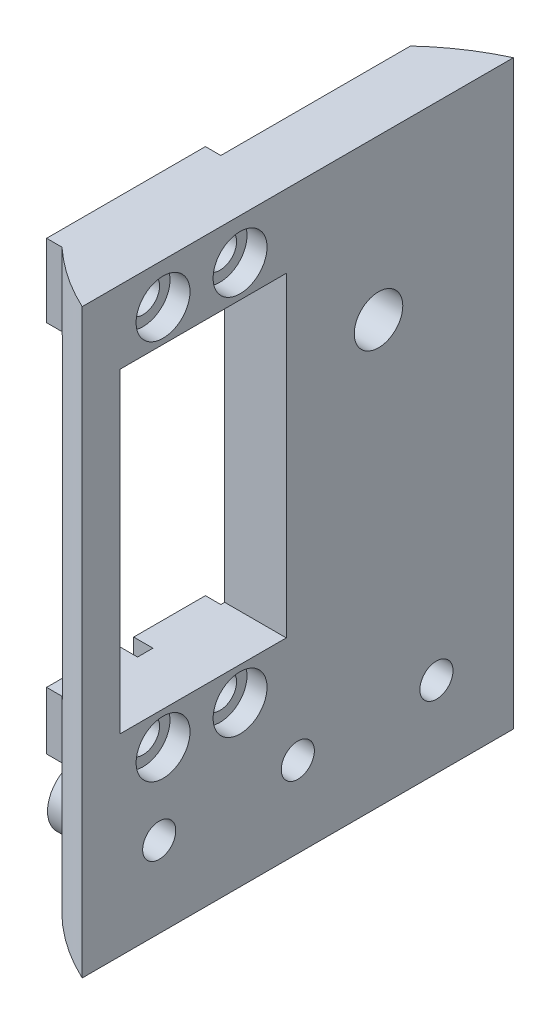
from build123d import *
from build123d.topology import SkipClean

# Parameters (mm, degrees)
SKETCH1_R                = 28
BOSS_EXTRUDE1_DEPTH      = 3
SKETCH2_R                = 1.625
CUT_EXTRUDE1_DEPTH       = 3
BOSS_EXTRUDE4_START      = 3
BOSS_EXTRUDE4_OUTLINE_R  = 1.625
BOSS_EXTRUDE4_DEPTH      = 70
BOSS_EXTRUDE6_DEPTH      = 7
CUT_EXTRUDE13_START      = -10
CUT_EXTRUDE13_DEPTH      = 10
SKETCH14_R               = 3.15
CUT_EXTRUDE7_DEPTH       = 54
SKETCH17_R               = 2.15
CUT_EXTRUDE10_DEPTH      = 15.8
CUT_EXTRUDE12_START      = -3
CUT_EXTRUDE12_DEPTH      = 3
SKETCH21_W               = 20.621892052
SKETCH21_H               = 10
BOSS_EXTRUDE7_DEPTH      = 7
SKETCH23_R               = 2.15
CUT_EXTRUDE17_DEPTH      = 23
SKETCH26_W               = 20.621892052
SKETCH26_H               = 58
CUT_EXTRUDE21_DEPTH      = 5
CUT_EXTRUDE22_DEPTH      = 5
SKETCH41_R               = 1.625
CUT_EXTRUDE23_DEPTH      = 70
CUT_EXTRUDE24_START      = -39
CUT_EXTRUDE24_DEPTH      = 39
BOSS_EXTRUDE12_START     = -3
SKETCH43_R               = 30.866648668
BOSS_EXTRUDE12_DEPTH     = 3
BOSS_EXTRUDE13_DEPTH     = 70
BOSS_EXTRUDE14_DEPTH     = 70
SKETCH47_R               = 1.625
SKETCH47_R_2             = 1.65
CUT_EXTRUDE26_DEPTH      = 39
SKETCH51_R               = 3.5
CUT_EXTRUDE30_DEPTH      = 2.6
CUT_EXTRUDE31_DEPTH      = 79
CUT_EXTRUDE31_DEPTH_BACK = 23
SKETCH53_R               = 2.15
CUT_EXTRUDE32_DEPTH      = 17
SKETCH56_R               = 4
SKETCH56_R_2             = 2.15
BOSS_EXTRUDE15_DEPTH     = 2.5
SKETCH57_W               = 20.621892052
SKETCH57_H               = 40
CUT_EXTRUDE33_DEPTH      = 10
SKETCH58_W               = 2
SKETCH58_H               = 6.5
CUT_EXTRUDE34_DEPTH      = 2.5
SKETCH59_R               = 1.65
BOSS_EXTRUDE16_DEPTH     = 2.5


# Read off the part's stored shape, not the designer's step: Boss-Extrude4, Cut-Extrude13
with BuildPart() as part:
    # Sketch1 → Boss-Extrude1 (new body)
    with BuildSketch(Plane(origin=(0, 0, 0), x_dir=(1, 0, 0), z_dir=(0, 1, 0))):
        with Locations(Location((20, 12.5, 0), (0, 0, 270))):
            Circle(SKETCH1_R)
    extrude(amount=BOSS_EXTRUDE1_DEPTH)

    # Sketch2 → Cut-Extrude1 (cut)
    with BuildSketch(Plane(origin=(0, 3, 0), x_dir=(1, 0, 0), z_dir=(0, 1, 0))):
        with Locations(Location((20, 19.5, 0), (0, 0, 270))):
            Circle(SKETCH2_R)
        with Locations(Location((20, 5.5, 0), (0, 0, 270))):
            Circle(SKETCH2_R)
        with Locations(Location((20, 12.5, 0), (0, 0, 270))):
            Circle(SKETCH2_R)
    extrude(amount=-CUT_EXTRUDE1_DEPTH, mode=Mode.SUBTRACT)

    # Boss-Extrude4 outline → Boss-Extrude4 (add)
    with SkipClean():  # the faces are left unmerged after this step: merging them gives an invalid solid
        with BuildSketch(Plane(origin=(0, 0, 0), x_dir=(1, 0, 0), z_dir=(0, 1, 0)).offset(BOSS_EXTRUDE4_START)):
            with BuildLine():
                ThreePointArc((3.5, -10.121892052), (48, 12.5), (3.5, 35.121892052))
                Line((3.5, 35.121892052), (3.5, -10.121892052))
            make_face()
            with Locations((20, 5.5)):
                Circle(BOSS_EXTRUDE4_OUTLINE_R, mode=Mode.SUBTRACT)
            with Locations((20, 12.5)):
                Circle(BOSS_EXTRUDE4_OUTLINE_R, mode=Mode.SUBTRACT)
            with Locations((20, 19.5)):
                Circle(BOSS_EXTRUDE4_OUTLINE_R, mode=Mode.SUBTRACT)
        extrude(amount=BOSS_EXTRUDE4_DEPTH)
    add(part.part.scale(1), mode=Mode.REPLACE)  # the faces are merged on a copy

    # Sketch13 → Boss-Extrude6 (add)
    with BuildSketch(Plane.ZY.offset(-3.5)):
        Polygon((-10, 23), (10, 23), (10.121892052, 23), (10.121892052, 15), (10, 15), (-10, 15), (-10.5, 15), (-10.5, 23), align=None)
    extrude(amount=BOSS_EXTRUDE6_DEPTH)

    # Cut-Extrude13 outline → Cut-Extrude13 (cut)
    with BuildSketch(Plane.ZY.offset(-3.5).offset(CUT_EXTRUDE13_START)):
        with BuildLine():
            Line((-10.5, 33), (-10.5, 23))
            Line((-10.5, 23), (10.121892052, 23))
            Line((10.121892052, 23), (10.121892052, 35.792364821))
            ThreePointArc((10.121892052, 35.792364821), (-1.408923961, 43.405043646), (-10.5, 33))
        make_face()
    extrude(amount=CUT_EXTRUDE13_DEPTH, mode=Mode.SUBTRACT)

    # Sketch14 → Cut-Extrude7 (cut)
    with BuildSketch(Plane.ZY.offset(-3.5)):
        with Locations((-22.981333294, 52.283628291)):
            Circle(SKETCH14_R)
    extrude(amount=-CUT_EXTRUDE7_DEPTH, mode=Mode.SUBTRACT)

    # Sketch17 → Cut-Extrude10 (cut)
    with BuildSketch(Plane.ZY.offset(3.5)):
        with Locations((-5, 18.2)):
            Circle(SKETCH17_R)
        with Locations((5, 18.2)):
            Circle(SKETCH17_R)
    extrude(amount=-CUT_EXTRUDE10_DEPTH, mode=Mode.SUBTRACT)

    # Sketch19 → Cut-Extrude12 (cut)
    with BuildSketch(Plane.ZY.offset(-3.5).offset(CUT_EXTRUDE12_START)):
        with BuildLine():
            Line((10.121892052, 63), (10.121892052, 35.792364821))
            ThreePointArc((10.121892052, 35.792364821), (-1.408923961, 43.405043646), (-10.5, 33))
            Line((-10.5, 33), (-10.5, 62))
            Line((-10.5, 62), (-10.5, 63))
            Line((-10.5, 63), (10.121892052, 63))
        make_face()
    extrude(amount=CUT_EXTRUDE12_DEPTH, mode=Mode.SUBTRACT)

    # Sketch21 → Boss-Extrude7 (add)
    with BuildSketch(Plane.ZY.offset(-3.5)):
        with Locations((-0.189053974, 68)):
            Rectangle(SKETCH21_W, SKETCH21_H)
    extrude(amount=BOSS_EXTRUDE7_DEPTH)

    # Sketch23 → Cut-Extrude17 (cut)
    with BuildSketch(Plane.ZY.offset(3.5)):
        with Locations((-5, 67.7)):
            Circle(SKETCH23_R)
        with Locations((5, 67.7)):
            Circle(SKETCH23_R)
    extrude(amount=-CUT_EXTRUDE17_DEPTH, mode=Mode.SUBTRACT)

    # Sketch26 → Cut-Extrude21 (cut)
    with BuildSketch(Plane.ZY.offset(3.5)):
        with Locations((-0.189053974, 44)):
            Rectangle(SKETCH26_W, SKETCH26_H)
    extrude(amount=-CUT_EXTRUDE21_DEPTH, mode=Mode.SUBTRACT)

    # Sketch27 → Cut-Extrude22 (cut)
    with BuildSketch(Plane.ZY.offset(-6.5)):
        Polygon((10.121892052, 63), (-10.5, 63), (-10.5, 33), (10.121892052, 35.792364821), align=None)
    extrude(amount=-CUT_EXTRUDE22_DEPTH, mode=Mode.SUBTRACT)

    # Sketch41 → Cut-Extrude23 (cut)
    with BuildSketch(Plane(origin=(0, 73, 0), x_dir=(1, 0, 0), z_dir=(0, 1, 0))):
        with BuildLine():
            Line((11.5, 39.178643144), (11.5, 10.5))
            Line((11.5, 10.5), (11.5, -14.178643144))
            ThreePointArc((11.5, -14.178643144), (48, 12.5), (11.5, 39.178643144))
        make_face()
        with Locations(Location((20, 5.5, 0), (0, 0, 270))):
            Circle(SKETCH41_R, mode=Mode.SUBTRACT)
        with Locations(Location((20, 12.5, 0), (0, 0, 270))):
            Circle(SKETCH41_R, mode=Mode.SUBTRACT)
        with Locations(Location((20, 19.5, 0), (0, 0, 270))):
            Circle(SKETCH41_R, mode=Mode.SUBTRACT)
    extrude(amount=-CUT_EXTRUDE23_DEPTH, mode=Mode.SUBTRACT)

    # Sketch42 → Cut-Extrude24 (cut)
    with SkipClean():  # the faces are left unmerged after this step: merging them gives an invalid solid
        with BuildSketch(Plane(origin=(0, 3, 0), x_dir=(1, 0, 0), z_dir=(0, 1, 0)).offset(CUT_EXTRUDE24_START)):
            with BuildLine():
                ThreePointArc((3.5, 35.121892052), (-6.366648668, 12.5), (3.5, -10.121892052))
                ThreePointArc((3.5, -10.121892052), (-8, 12.5), (3.5, 35.121892052))
            make_face()
        extrude(amount=CUT_EXTRUDE24_DEPTH, mode=Mode.SUBTRACT)

    # Sketch43 → Boss-Extrude12 (add)
    with SkipClean():  # the faces are left unmerged after this step: merging them gives an invalid solid
        with BuildSketch(Plane(origin=(0, 3, 0), x_dir=(1, 0, 0), z_dir=(0, 1, 0)).offset(BOSS_EXTRUDE12_START)):
            with Locations(Location((24.5, 12.5, 0), (0, 0, 270))):
                Circle(SKETCH43_R)
        extrude(amount=BOSS_EXTRUDE12_DEPTH)
    add(part.part.scale(1), mode=Mode.REPLACE)  # the faces are merged on a copy

    # Sketch45 → Boss-Extrude13 (add)
    with BuildSketch(Plane(origin=(0, 3, 0), x_dir=(1, 0, 0), z_dir=(0, 1, 0))):
        with BuildLine():
            Line((11.5, 40.495535358), (11.5, 39.178643144))
            ThreePointArc((11.5, 39.178643144), (7.336497035, 37.472698946), (3.5, 35.121892052))
            ThreePointArc((3.5, 35.121892052), (7.288985777, 38.12286068), (11.5, 40.495535358))
        make_face()
        with BuildLine():
            Line((11.5, -14.178643144), (11.5, -15.495535358))
            ThreePointArc((11.5, -15.495535358), (7.288985777, -13.12286068), (3.5, -10.121892052))
            ThreePointArc((3.5, -10.121892052), (7.336497035, -12.472698946), (11.5, -14.178643144))
        make_face()
    extrude(amount=BOSS_EXTRUDE13_DEPTH)

    # Sketch46 → Boss-Extrude14 (add)
    with BuildSketch(Plane(origin=(0, 3, 0), x_dir=(1, 0, 0), z_dir=(0, 1, 0))):
        with BuildLine():
            Line((37.5, 40.495535358), (37.5, 12.5))
            Line((37.5, 12.5), (37.5, -15.495535358))
            ThreePointArc((37.5, -15.495535358), (41.711014223, -13.12286068), (45.5, -10.121892052))
            Line((45.5, -10.121892052), (45.5, 12.5))
            Line((45.5, 12.5), (45.5, 35.121892052))
            ThreePointArc((45.5, 35.121892052), (41.711014223, 38.12286068), (37.5, 40.495535358))
        make_face()
    extrude(amount=BOSS_EXTRUDE14_DEPTH)

    # Sketch47 → Cut-Extrude26 (cut)
    with BuildSketch(Plane(origin=(0, 3, 0), x_dir=(1, 0, 0), z_dir=(0, 1, 0))):
        with Locations(Location((24.638783134, 19.352080003, 0), (0, 0, 270))):
            Circle(SKETCH47_R)
        with Locations(Location((24.638783134, 12.352080003, 0), (0, 0, 270))):
            Circle(SKETCH47_R)
        with Locations(Location((-0.241381273, 1.593448641, 0), (0, 0, 270))):
            Circle(SKETCH47_R_2)
        with Locations(Location((48.503562926, 26.13041704, 0), (0, 0, 270))):
            Circle(SKETCH47_R)
        with Locations(Location((48.503562926, -1.426257034, 0), (0, 0, 270))):
            Circle(SKETCH47_R)
        with Locations(Location((24.638783134, -15.204594071, 0), (0, 0, 270))):
            Circle(SKETCH47_R)
        with Locations(Location((24.638783134, 39.908754076, 0), (0, 0, 270))):
            Circle(SKETCH47_R)
        with Locations(Location((30.700960961, 15.852080003, 0), (0, 0, 270))):
            Circle(SKETCH47_R)
        with Locations(Location((-2.490624188, 12.352080003, 0), (0, 0, 270))):
            Circle(SKETCH47_R_2)
        with Locations(Location((51.768190456, 12.352080003, 0), (0, 0, 270))):
            Circle(SKETCH47_R)
        with Locations(Location((24.638783134, 26.13041704, 0), (0, 0, 270))):
            Circle(SKETCH47_R)
        with Locations(Location((24.638783134, -1.426257034, 0), (0, 0, 270))):
            Circle(SKETCH47_R)
        with Locations(Location((30.700960961, 8.852080003, 0), (0, 0, 270))):
            Circle(SKETCH47_R)
        with Locations(Location((24.638783134, 5.352080003, 0), (0, 0, 270))):
            Circle(SKETCH47_R)
        with Locations(Location((18.576605308, 8.852080003, 0), (0, 0, 270))):
            Circle(SKETCH47_R)
        with Locations(Location((18.576605308, 15.852080003, 0), (0, 0, 270))):
            Circle(SKETCH47_R)
        with Locations(Location((-0.225996657, 23.13041704, 0), (0, 0, 270))):
            Circle(SKETCH47_R_2)
    extrude(amount=-CUT_EXTRUDE26_DEPTH, mode=Mode.SUBTRACT)

    # Sketch51 → Cut-Extrude30 (cut)
    with BuildSketch(Plane(origin=(11.5, 0, 0), x_dir=(0, 0, -1), z_dir=(1, 0, 0))):
        with Locations((-5, 18.2)):
            Circle(SKETCH51_R)
        with Locations((5, 18.2)):
            Circle(SKETCH51_R)
        with Locations((-5, 67.7)):
            Circle(SKETCH51_R)
        with Locations((5, 67.7)):
            Circle(SKETCH51_R)
    extrude(amount=-CUT_EXTRUDE30_DEPTH, mode=Mode.SUBTRACT)

    # Sketch52 → Cut-Extrude31 (cut, two sides: drawn at the far end of the back side and taken through both)
    with BuildSketch(Plane(origin=(0, 3, 0), x_dir=(1, 0, 0), z_dir=(0, 1, 0)).offset(-CUT_EXTRUDE31_DEPTH_BACK)):
        with BuildLine():
            Line((11.5, 40.495535358), (11.5, -15.495535358))
            ThreePointArc((11.5, -15.495535358), (55.366648668, 12.5), (11.5, 40.495535358))
        make_face()
    extrude(amount=CUT_EXTRUDE31_DEPTH + CUT_EXTRUDE31_DEPTH_BACK, mode=Mode.SUBTRACT)

    # Sketch53 → Cut-Extrude32 (cut)
    with BuildSketch(Plane(origin=(11.5, 0, 0), x_dir=(0, 0, -1), z_dir=(1, 0, 0))):
        with Locations((-5.5, 8)):
            Circle(SKETCH53_R)
        with Locations((12.5, 8)):
            Circle(SKETCH53_R)
        with Locations((30.5, 8)):
            Circle(SKETCH53_R)
    extrude(amount=-CUT_EXTRUDE32_DEPTH, mode=Mode.SUBTRACT)

    # Sketch56 → Boss-Extrude15 (add)
    # profile 1 of 3: a face of its own
    with BuildSketch(Plane.ZY.offset(-3.5)):
        with Locations((-30.5, 8)):
            Circle(SKETCH56_R)
        with Locations(Location((-30.5, 8, 0), (0, 0, 180))):
            Circle(SKETCH56_R_2, mode=Mode.SUBTRACT)
    # profile 2 of 3: a face of its own
    with BuildSketch(Plane.ZY.offset(-3.5)):
        with Locations((-12.5, 8)):
            Circle(SKETCH56_R)
        with Locations(Location((-12.5, 8, 0), (0, 0, 180))):
            Circle(SKETCH56_R_2, mode=Mode.SUBTRACT)
    # profile 3 of 3: a face of its own
    with BuildSketch(Plane.ZY.offset(-3.5)):
        with Locations((5.5, 8)):
            Circle(SKETCH56_R)
        with Locations(Location((5.5, 8, 0), (0, 0, 180))):
            Circle(SKETCH56_R_2, mode=Mode.SUBTRACT)
    extrude(amount=BOSS_EXTRUDE15_DEPTH)

    # Sketch57 → Cut-Extrude33 (cut)
    with BuildSketch(Plane(origin=(11.5, 0, 0), x_dir=(0, 0, -1), z_dir=(1, 0, 0))):
        Polygon((-10.621892052, 63.5), (-10.621892052, 63), (-10.621892052, 22.5), (-10.121892052, 22.5), (11, 22.5), (11, 23), (11, 63.5), (10.5, 63.5), align=None)
        with Locations((0.189053974, 43)):
            Rectangle(SKETCH57_W, SKETCH57_H, mode=Mode.SUBTRACT)
    extrude(amount=-CUT_EXTRUDE33_DEPTH, mode=Mode.SUBTRACT)

    # Sketch58 → Cut-Extrude34 (cut)
    with BuildSketch(Plane.ZY.offset(-1.5)):
        Polygon((-0.189053974, 22.5), (-1.189053974, 22.5), (-1.189053974, 16), (0.810946026, 16), (0.810946026, 22.5), align=None)
        with Locations((-0.189053974, 66.75)):
            Rectangle(SKETCH58_W, SKETCH58_H)
    extrude(amount=-CUT_EXTRUDE34_DEPTH, mode=Mode.SUBTRACT)

    # Sketch59 → Boss-Extrude16 (add)
    with BuildSketch(Plane.XZ):
        with BuildLine():
            Line((11.5, -40.495535358), (11.5, 15.495535358))
            ThreePointArc((11.5, 15.495535358), (-6.366648668, -12.5), (11.5, -40.495535358))
        make_face()
        with Locations(Location((-0.225996657, -23.13041704, 0), (0, 0, 90))):
            Circle(SKETCH59_R, mode=Mode.SUBTRACT)
        with Locations(Location((-2.490624188, -12.352080003, 0), (0, 0, 90))):
            Circle(SKETCH59_R, mode=Mode.SUBTRACT)
        with Locations(Location((-0.241381273, -1.593448641, 0), (0, 0, 90))):
            Circle(SKETCH59_R, mode=Mode.SUBTRACT)
    extrude(amount=BOSS_EXTRUDE16_DEPTH)


solid = part.part
